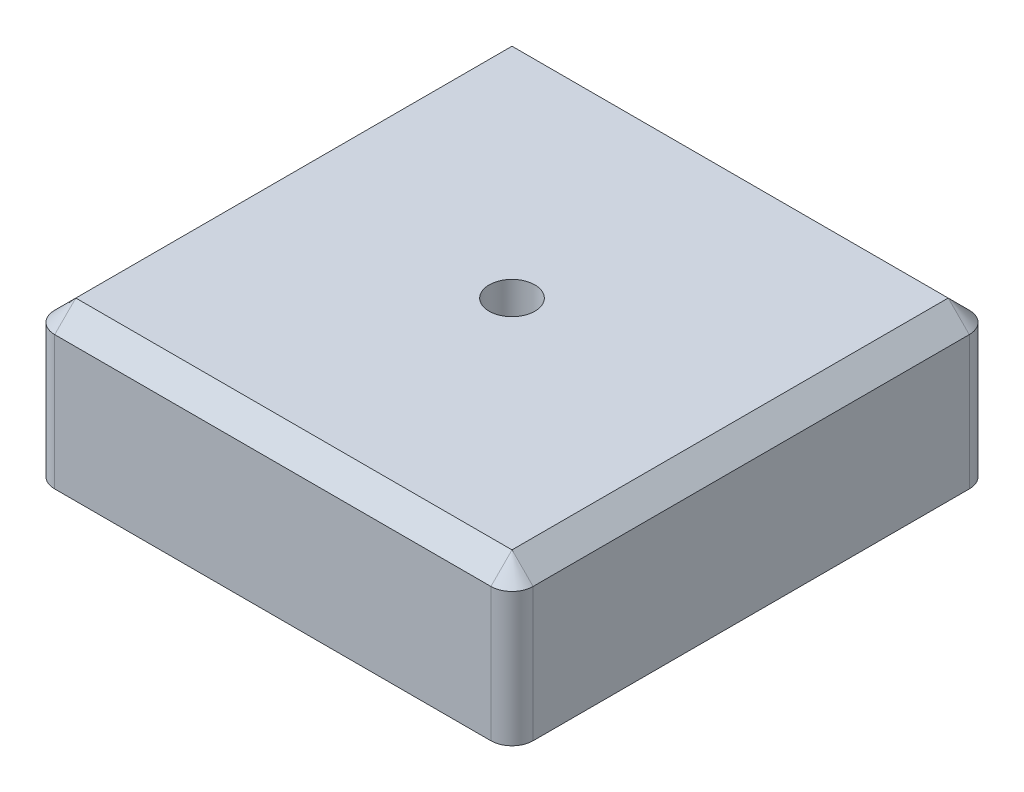
from build123d import *

# Parameters (mm, degrees)
SKETCH1_W           = 68
SKETCH1_H           = 68
BOSS_EXTRUDE1_DEPTH = 10
SKETCH4_W           = 68
SKETCH4_H           = 68
SKETCH4_W_2         = 30
SKETCH4_H_2         = 30
BOSS_EXTRUDE3_DEPTH = 12
FILLET2_R           = 3
FILLET3_R           = 3
SKETCH5_R           = 3.25
CUT_EXTRUDE2_DEPTH  = 20
CHAMFER1_SIZE       = 3
CHAMFER2_SIZE       = 3


with BuildPart() as part:
    # Sketch1 → Boss-Extrude1 (new body)
    with BuildSketch(Plane(origin=(0, 0, 0), x_dir=(1, 0, 0), z_dir=(0, 1, 0))):
        Rectangle(SKETCH1_W, SKETCH1_H)
    extrude(amount=BOSS_EXTRUDE1_DEPTH)

    # Sketch4 → Boss-Extrude3 (add)
    with BuildSketch(Plane.XZ):
        Rectangle(SKETCH4_W, SKETCH4_H)
        Rectangle(SKETCH4_W_2, SKETCH4_H_2, mode=Mode.SUBTRACT)
    extrude(amount=BOSS_EXTRUDE3_DEPTH)

    # Fillet2
    fillet2_edges = [part.edges().sort_by_distance(p)[0] for p in [
        (34, -1, 34),
        (-34, -1, 34),
        (-34, -1, -34),
        (34, -1, -34),
    ]]
    fillet(fillet2_edges, radius=FILLET2_R)

    # Fillet3
    fillet3_edges = [part.edges().sort_by_distance(p)[0] for p in [
        (15, -6, 15),
        (-15, -6, 15),
        (-15, -6, -15),
        (15, -6, -15),
    ]]
    fillet(fillet3_edges, radius=FILLET3_R)

    # Sketch5 → Cut-Extrude2 (cut)
    with BuildSketch(Plane.XZ):
        with Locations(Location((0, 0, 0), (0, 0, 270))):
            Circle(SKETCH5_R)
    extrude(amount=-CUT_EXTRUDE2_DEPTH, mode=Mode.SUBTRACT)

    # Chamfer1
    chamfer1_edges = [part.edges().sort_by_distance(p)[0] for p in [
        (34, 10, 0),
        (0, 10, 34),
        (0, 10, -34),
        (-34, 10, 0),
        (-33.121320344, 10, -33.121320344),
        (33.121320344, 10, -33.121320344),
        (-33.121320344, 10, 33.121320344),
        (33.121320344, 10, 33.121320344),
    ]]
    chamfer(chamfer1_edges, length=CHAMFER1_SIZE - 0.0001)  # a hair under: the kernel refuses the full size

    # Chamfer2
    chamfer2_edges = [part.edges().sort_by_distance(p)[0] for p in [
        (0, 0, 15),
        (0, 0, -15),
        (15, 0, 0),
        (-15, 0, 0),
        (14.121320344, 0, 14.121320344),
        (14.121320344, 0, -14.121320344),
        (-14.121320344, 0, -14.121320344),
        (-14.121320344, 0, 14.121320344),
    ]]
    chamfer(chamfer2_edges, length=CHAMFER2_SIZE - 0.0001)  # a hair under: the kernel refuses the full size


solid = part.part
